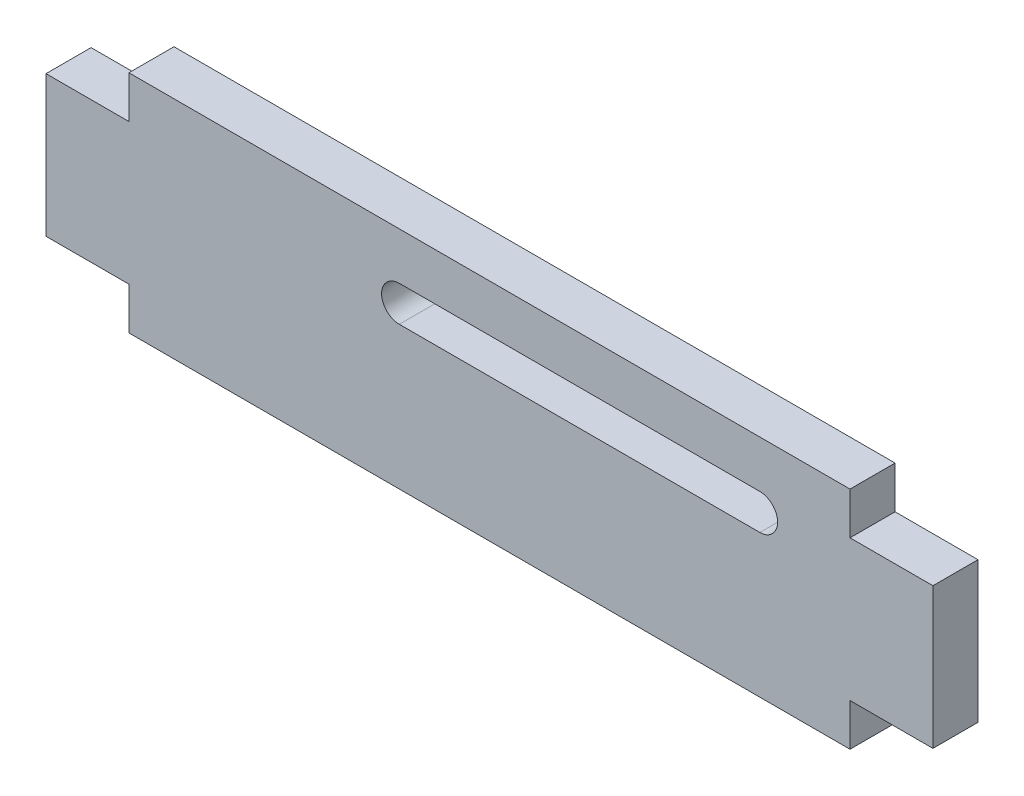
from build123d import *

# Parameters (mm, degrees)
BOSS_EXTRUDE1_DEPTH = 3.175


with BuildPart() as part:
    # Sketch1 → Boss-Extrude1 (new body)
    with BuildSketch(Plane.XY):
        Polygon((-25.4, -7.9375), (25.4, -7.9375), (25.4, -4.9625), (31.242, -4.9625), (31.242, 4.9625), (25.4, 4.9625), (25.4, 7.9375), (-25.4, 7.9375), (-25.4, 4.9625), (-31.242, 4.9625), (-31.242, -4.9625), (-25.4, -4.9625), align=None)
        with BuildLine():
            Line((-6.35, 4.6155), (19.05, 4.6155))
            ThreePointArc((19.05, 4.6155), (20.3, 3.3655), (19.05, 2.1155))
            Line((19.05, 2.1155), (-6.35, 2.1155))
            ThreePointArc((-6.35, 2.1155), (-7.6, 3.3655), (-6.35, 4.6155))
        make_face(mode=Mode.SUBTRACT)
    extrude(amount=BOSS_EXTRUDE1_DEPTH)


solid = part.part
